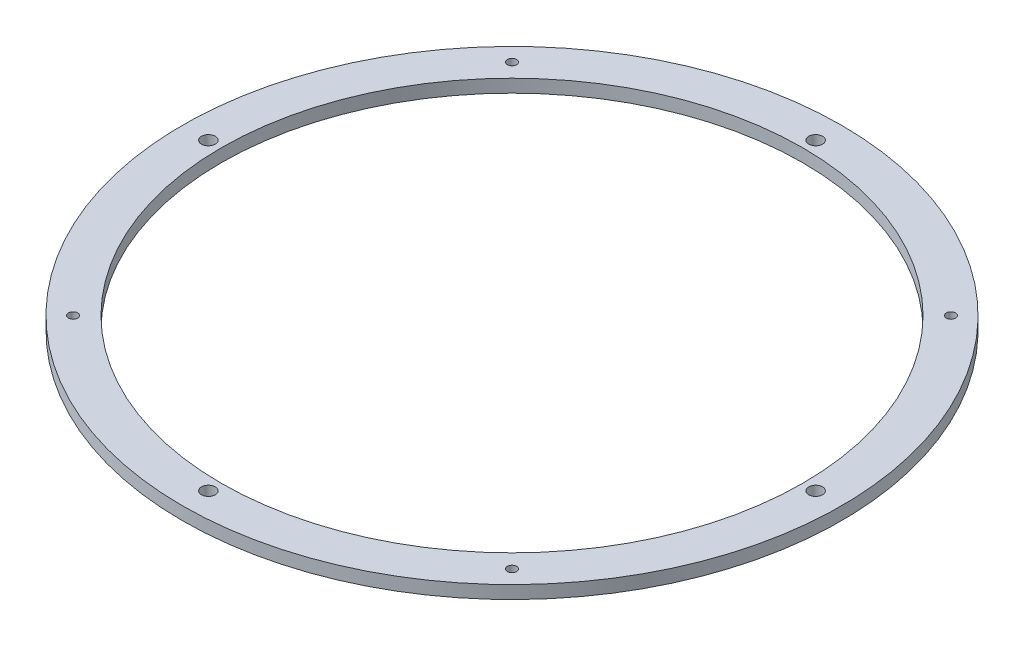
from build123d import *

# Parameters (mm, degrees)
SKETCH1_R               = 161.4
SKETCH1_R_2             = 142.35
BOSS_EXTRUDE1_DEPTH     = 6.35
F_1_4_CLEARANCE_HOLE1_D = 6.7564
CIRPATTERN1_COUNT       = 4
M4_CLEARANCE_HOLE1_D    = 4.5
CIRPATTERN2_COUNT       = 4


with BuildPart() as part:
    # Sketch1 → Boss-Extrude1 (new body)
    with BuildSketch(Plane(origin=(0, 0, 0), x_dir=(1, 0, 0), z_dir=(0, 1, 0))):
        Circle(SKETCH1_R)
        Circle(SKETCH1_R_2, mode=Mode.SUBTRACT)
    extrude(amount=BOSS_EXTRUDE1_DEPTH)

    # 1/4 Clearance Hole1 (through all)
    with Locations(Plane(origin=(0, 6.35, 0), x_dir=(1, 0, 0), z_dir=(0, 1, 0))):
        with Locations((0, -148.7)):
            f_1_4_clearance_hole1 = Hole(F_1_4_CLEARANCE_HOLE1_D / 2)

    # CirPattern1: 1/4 Clearance Hole1 ×4 about axis
    cirpattern1_axis = Axis((0, 6.35, 0), (0, -1, 0))
    for i in range(1, CIRPATTERN1_COUNT):
        add(f_1_4_clearance_hole1.rotate(cirpattern1_axis, i * 360 / CIRPATTERN1_COUNT), mode=Mode.SUBTRACT)

    # M4 Clearance Hole1 (through all)
    with Locations(Plane(origin=(0, 6.35, 0), x_dir=(1, 0, 0), z_dir=(0, 1, 0))):
        with Locations((-107.48023074, 107.48023074)):
            m4_clearance_hole1 = Hole(M4_CLEARANCE_HOLE1_D / 2)

    # CirPattern2: M4 Clearance Hole1 ×4 about axis
    cirpattern2_axis = Axis((0, 6.35, 0), (0, -1, 0))
    for i in range(1, CIRPATTERN2_COUNT):
        add(m4_clearance_hole1.rotate(cirpattern2_axis, i * 360 / CIRPATTERN2_COUNT), mode=Mode.SUBTRACT)


solid = part.part
